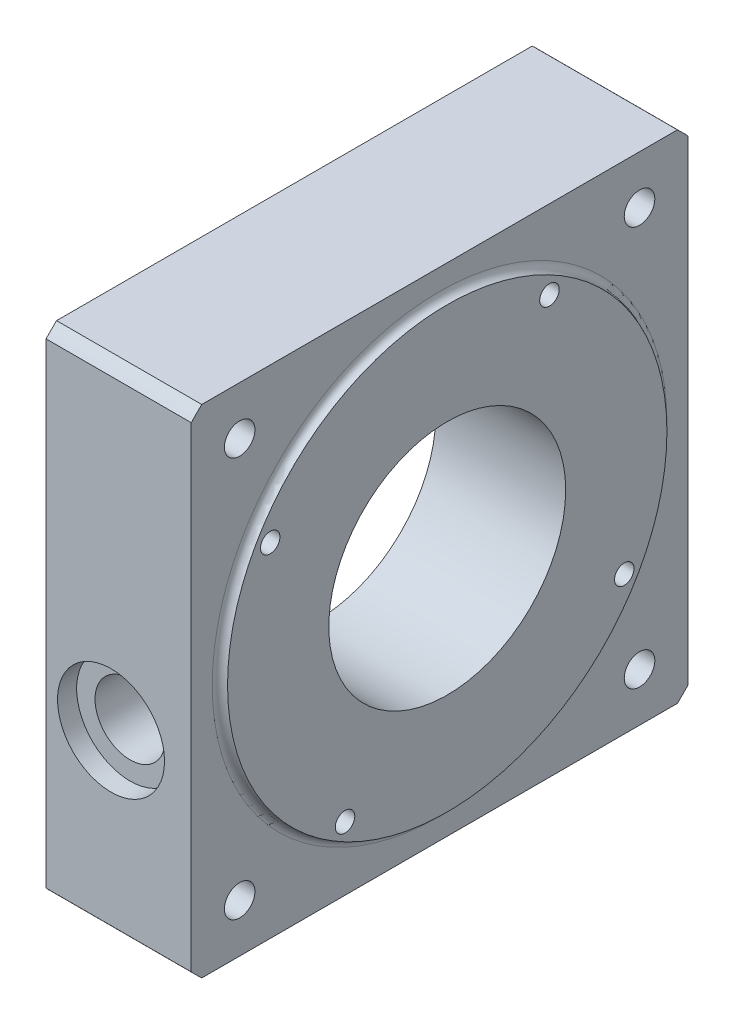
from build123d import *

# Parameters (mm, degrees)
SALIENTE_EXTRUIR1_DEPTH            = 38
TALADRO_DE_MARGEN_PARA_M1001_D     = 114.5
TALADRO_DE_MARGEN_PARA_M1001_DEPTH = 6
CROQUIS9_W                         = 34
CROQUIS9_H                         = 31
TALADRO_DE_MARGEN_PARA_M71_D       = 8


# Read off the part's stored shape, not the designer's step: Refrentado para perno con cabeza hexagonal de M161
with BuildPart() as part:
    # Croquis1 → Saliente-Extruir1 (new body)
    with BuildSketch(Plane(origin=(-94.5, 0, 0), x_dir=(0, -1, 0), z_dir=(-1, 0, 0))):
        with BuildLine():
            Line((62.24949799, 65), (-62.24949799, 65))
            ThreePointArc((-62.24949799, 65), (-63.639610307, 63.639610307), (-65, 62.24949799))
            Line((-65, 62.24949799), (-65, -62.24949799))
            ThreePointArc((-65, -62.24949799), (-63.639610307, -63.639610307), (-62.24949799, -65))
            Line((-62.24949799, -65), (62.24949799, -65))
            ThreePointArc((62.24949799, -65), (63.639610307, -63.639610307), (65, -62.24949799))
            Line((65, -62.24949799), (65, 62.24949799))
            ThreePointArc((65, 62.24949799), (63.639610307, 63.639610307), (62.24949799, 65))
        make_face()
    extrude(amount=-SALIENTE_EXTRUIR1_DEPTH)

    # Taladro de margen para M1001
    with Locations(Plane.ZY.offset(94.5)):
        with Locations((0, 0)):
            Hole(TALADRO_DE_MARGEN_PARA_M1001_D / 2, depth=TALADRO_DE_MARGEN_PARA_M1001_DEPTH)

    # Croquis4 → Revolución1 (revolve)
    with BuildSketch(Plane(origin=(0, 0, 0), x_dir=(-1, 0, 0), z_dir=(0, 0, -1)), mode=Mode.PRIVATE) as revoluci_n1_sk:
        with BuildLine():
            Line((54.5, 57.5), (54.5, 0))
            Line((54.5, 0), (56.5, 0))
            Line((56.5, 0), (56.5, 59.5))
            ThreePointArc((56.5, 59.5), (55.914213562, 58.085786438), (54.5, 57.5))
        make_face()
    revolve(revoluci_n1_sk.sketch.rotate(Axis((-54.499975, 0, 0), (-1, 0, 0)), 270), axis=Axis((-54.499975, 0, 0), (-1, 0, 0)))

    # Croquis5 → Cortar-Revolución1 (revolve, cut)
    with BuildSketch(Plane(origin=(0, 0, 46.3323591), x_dir=(-1, 0, 0), z_dir=(0, 0, -1)), mode=Mode.PRIVATE) as cortar_revoluci_n1_sk:
        Polygon((54.5, 29.3), (54.5, 26.75), (94.5, 26.75), (94.5, 32.75), (63.5, 32.75), (63.5, 29.3), align=None)
    revolve(cortar_revoluci_n1_sk.sketch.rotate(Axis((-54.5, 26.75, 46.3323591), (-1, 0, 0)), 270), axis=Axis((-54.5, 26.75, 46.3323591), (-1, 0, 0)), mode=Mode.SUBTRACT)

    # Croquis6 → Cortar-Revolución2 (revolve, cut)
    with BuildSketch(Plane(origin=(0, 0, -26.75), x_dir=(-1, 0, 0), z_dir=(0, 0, -1)), mode=Mode.PRIVATE) as cortar_revoluci_n2_sk:
        Polygon((54.5, 48.8823591), (54.5, 46.3323591), (94.5, 46.3323591), (94.5, 52.3323591), (63.5, 52.3323591), (63.5, 48.8823591), align=None)
    revolve(cortar_revoluci_n2_sk.sketch.rotate(Axis((-54.5, 46.3323591, -26.75), (-1, 0, 0)), 270), axis=Axis((-54.5, 46.3323591, -26.75), (-1, 0, 0)), mode=Mode.SUBTRACT)

    # Croquis7 → Cortar-Revolución3 (revolve, cut)
    with BuildSketch(Plane(origin=(0, 0, -46.3323591), x_dir=(-1, 0, 0), z_dir=(0, 0, -1)), mode=Mode.PRIVATE) as cortar_revoluci_n3_sk:
        Polygon((54.5, -24.2), (54.5, -26.75), (94.5, -26.75), (94.5, -20.75), (63.5, -20.75), (63.5, -24.2), align=None)
    revolve(cortar_revoluci_n3_sk.sketch.rotate(Axis((-54.5, -26.75, -46.3323591), (-1, 0, 0)), 270), axis=Axis((-54.5, -26.75, -46.3323591), (-1, 0, 0)), mode=Mode.SUBTRACT)

    # Croquis8 → Cortar-Revolución4 (revolve, cut)
    with BuildSketch(Plane(origin=(0, 0, 26.75), x_dir=(-1, 0, 0), z_dir=(0, 0, -1)), mode=Mode.PRIVATE) as cortar_revoluci_n4_sk:
        Polygon((54.5, -43.7823591), (54.5, -46.3323591), (94.5, -46.3323591), (94.5, -40.3323591), (63.5, -40.3323591), (63.5, -43.7823591), align=None)
    revolve(cortar_revoluci_n4_sk.sketch.rotate(Axis((-54.5, -46.3323591, 26.75), (-1, 0, 0)), 270), axis=Axis((-54.5, -46.3323591, 26.75), (-1, 0, 0)), mode=Mode.SUBTRACT)

    # Croquis9 → Cortar-Revolución5 (revolve, cut)
    with BuildSketch(Plane.XY, mode=Mode.PRIVATE) as cortar_revoluci_n5_sk:
        with Locations((-71.5, 15.5)):
            Rectangle(CROQUIS9_W, CROQUIS9_H)
    revolve(cortar_revoluci_n5_sk.sketch.rotate(Axis((-88.5, 0, 0), (1, 0, 0)), 270), axis=Axis((-88.5, 0, 0), (1, 0, 0)), mode=Mode.SUBTRACT)

    # Refrentado para perno con cabeza hex 2 → Refrentado para perno con cabeza hexagonal de M161 (revolve, cut)
    with BuildSketch(Plane(origin=(-77.5, -18, 0), x_dir=(1, 0, 0), z_dir=(0, -1, 0))):
        Polygon((0, 14.891701752), (9.188095, 14.891701752), (9.188095, 60), (14, 60), (14, 65), (0, 65), align=None)
    revolve(axis=Axis((-77.5, -18, 0), (0, 0, 1)), mode=Mode.SUBTRACT)

    # Taladro de margen para M71 (through all)
    with Locations(Plane.ZY.offset(94.5)):
        with Locations((-52.325901808, 52.325901808), (52.325901808, 52.325901808), (52.325901808, -52.325901808), (-52.325901808, -52.325901808)):
            Hole(TALADRO_DE_MARGEN_PARA_M71_D / 2)


solid = part.part
